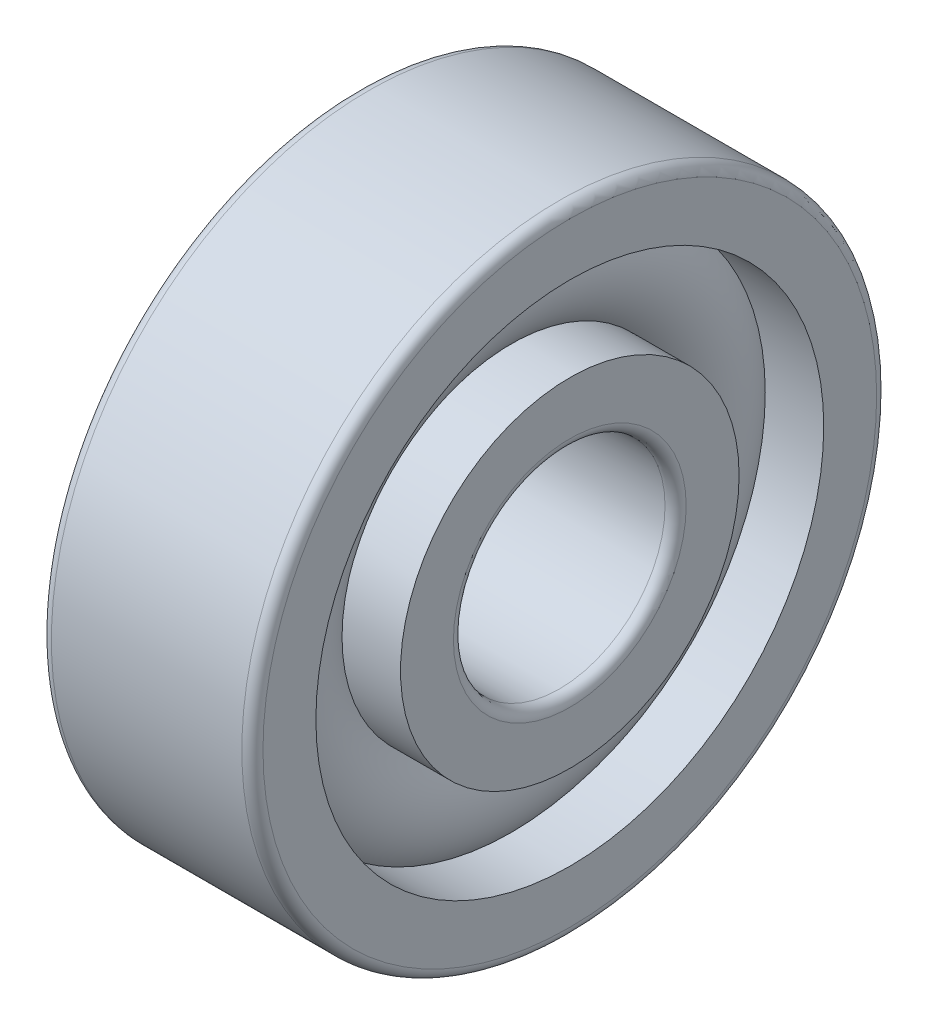
from build123d import *

# Parameters (mm, degrees)
CAGSPISKE_W     = 0.24
CAGSPISKE_H     = 0.4
CAGESPINE_ANGLE = 0.001
BALSIMSKE_R     = 1.2


with BuildPart() as part:
    # CagSpiSke → CageSpine (revolve)
    with BuildSketch(Plane.XY):
        with Locations((0, 4)):
            Rectangle(CAGSPISKE_W, CAGSPISKE_H)
    revolve(axis=Axis((-20.6375, 0, 0), (-1, 0, 0)), revolution_arc=CAGESPINE_ANGLE)

    # BalSimSke → BallsSimplified (revolve)
    with BuildSketch(Plane.XY):
        with Locations((0, 4)):
            Circle(BALSIMSKE_R)
    revolve(axis=Axis((-10, 0, 0), (1, 0, 0)))

    # InnRacSke → InnerRace (revolve)
    with BuildSketch(Plane.XY):
        with BuildLine():
            Line((-0.860595724, 3.2), (-2, 3.2))
            Line((-2, 3.2), (-2, 2.2))
            ThreePointArc((-2, 2.2), (-1.941421356, 2.058578644), (-1.8, 2))
            Line((-1.8, 2), (1.8, 2))
            ThreePointArc((1.8, 2), (1.941421356, 2.058578644), (2, 2.2))
            Line((2, 2.2), (2, 3.2))
            Line((2, 3.2), (0.860595724, 3.2))
            ThreePointArc((0.860595724, 3.2), (0, 2.825), (-0.860595724, 3.2))
        make_face()
    revolve(axis=Axis((-20.6375, 0, 0), (1, 0, 0)))

    # OutRacSke → OuterRace (revolve)
    with BuildSketch(Plane.XY):
        with BuildLine():
            Line((-0.860595724, 4.8), (-2, 4.8))
            Line((-2, 4.8), (-2, 5.8))
            ThreePointArc((-2, 5.8), (-1.941421356, 5.941421356), (-1.8, 6))
            Line((-1.8, 6), (1.8, 6))
            ThreePointArc((1.8, 6), (1.941421356, 5.941421356), (2, 5.8))
            Line((2, 5.8), (2, 4.8))
            Line((2, 4.8), (0.860595724, 4.8))
            ThreePointArc((0.860595724, 4.8), (0, 5.175), (-0.860595724, 4.8))
        make_face()
    revolve(axis=Axis((-20.6375, 0, 0), (1, 0, 0)))


solid = part.part
